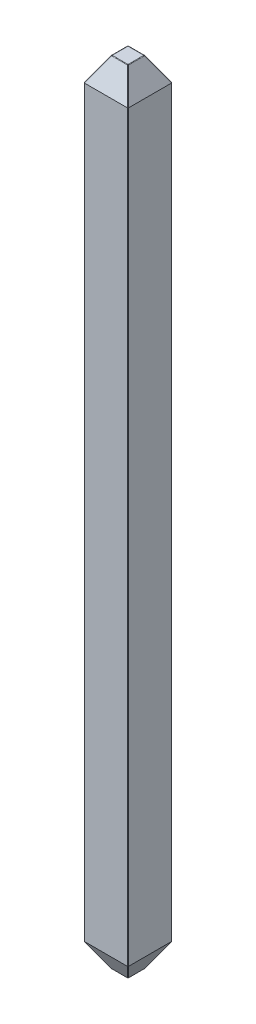
from build123d import *

# Parameters (mm, degrees)
SKETCH1_W           = 0.64
SKETCH1_H           = 0.64
BOSS_EXTRUDE1_DEPTH = 11.5
CHAMFER1_SIZE       = 0.2
CHAMFER1_SIZE2      = 0.346410162
CHAMFER2_SIZE       = 0.2
CHAMFER2_SIZE2      = 0.346410162
FILLET2_R           = 0.01


with BuildPart() as part:
    # Sketch1 → Boss-Extrude1 (new body)
    with BuildSketch(Plane(origin=(0, 0, 0), x_dir=(1, 0, 0), z_dir=(0, 1, 0))):
        Rectangle(SKETCH1_W, SKETCH1_H)
    extrude(amount=BOSS_EXTRUDE1_DEPTH)

    # Chamfer1
    chamfer1_edges = [part.edges().sort_by_distance(p)[0] for p in [
        (0, 11.5, 0.32),
        (-0.32, 11.5, 0),
        (0, 11.5, -0.32),
        (0.32, 11.5, 0),
    ]]
    chamfer1_side = [part.faces().sort_by_distance(p)[0] for p in [
        (0, 11.5, 0),
    ]]
    chamfer(chamfer1_edges, length=CHAMFER1_SIZE, length2=CHAMFER1_SIZE2, reference=chamfer1_side[0])

    # Chamfer2
    chamfer2_edges = [part.edges().sort_by_distance(p)[0] for p in [
        (0, 0, -0.32),
        (-0.32, 0, 0),
        (0, 0, 0.32),
        (0.32, 0, 0),
    ]]
    chamfer2_side = [part.faces().sort_by_distance(p)[0] for p in [
        (0, 0, 0),
    ]]
    chamfer(chamfer2_edges, length=CHAMFER2_SIZE, length2=CHAMFER2_SIZE2, reference=chamfer2_side[0])

    # Fillet2
    fillet2_edges = [part.edges().sort_by_distance(p)[0] for p in [
        (-0.12, 11.5, 0),
        (0, 11.5, 0.12),
        (0.12, 11.5, 0),
        (0, 11.5, -0.12),
        (0.22, 11.326794919, -0.22),
        (-0.22, 11.326794919, -0.22),
        (-0.22, 11.326794919, 0.22),
        (0.22, 11.326794919, 0.22),
        (-0.12, 0, 0),
        (0, 0, -0.12),
        (0, 0, 0.12),
        (0.12, 0, 0),
        (-0.22, 0.173205081, -0.22),
        (-0.22, 0.173205081, 0.22),
        (0.22, 0.173205081, -0.22),
        (0.22, 0.173205081, 0.22),
        (-0.32, 5.75, -0.32),
        (0.32, 5.75, -0.32),
        (0.32, 5.75, 0.32),
        (-0.32, 5.75, 0.32),
    ]]
    fillet(fillet2_edges, radius=FILLET2_R)


solid = part.part
